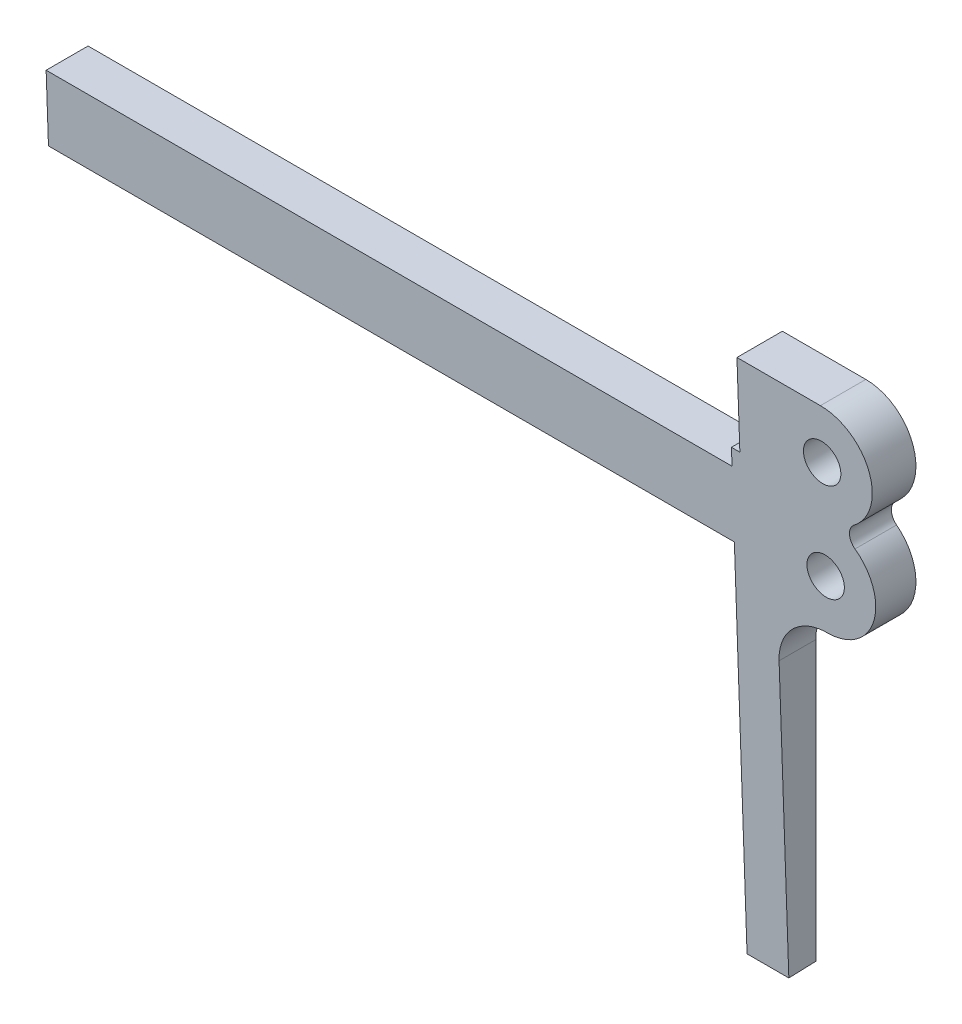
from build123d import *

# Parameters (mm, degrees)
BOSS_EXTRUDE1_OUTLINE_R = 3.556
BOSS_EXTRUDE1_OUTLINE_W = 260.9469
BOSS_EXTRUDE1_OUTLINE_H = 138.1252
BOSS_EXTRUDE1_DEPTH     = 76.2
CUT_EXTRUDE1_DEPTH      = 355.32482824
CUT_EXTRUDE1_DEPTH_BACK = 355.32482824
FILLET1_R               = 2.54
SKETCH7_W               = 260.9469
SKETCH7_H               = 22.1996
CUT_EXTRUDE2_DEPTH      = 347.152897849
FILLET2_R               = 6.35
SKETCH8_W               = 190.775627824
SKETCH8_H               = 235.521960295
CUT_EXTRUDE4_DEPTH      = 347.144751077
SKETCH9_W               = 165.75862987
SKETCH9_H               = 108.368614936
CUT_EXTRUDE5_DEPTH      = 227.747805823


# Read off the part's stored shape, not the designer's step: Boss-Extrude1
with BuildPart() as part:
    # Boss-Extrude1 outline → Boss-Extrude1 (new body)
    with BuildSketch(Plane.XY):
        with BuildLine():
            Line((-286.3596, -22.225), (9.525, -22.225))
            ThreePointArc((9.525, -22.225), (19.05, -12.7), (9.525, -3.175))
            ThreePointArc((9.525, -3.175), (19.05, 6.35), (9.525, 15.875))
            ThreePointArc((9.525, 15.875), (2.789807909, 18.664807909), (0, 25.4))
            Line((0, 25.4), (0, 131.7752))
            ThreePointArc((0, 131.7752), (2.789807909, 138.510392091), (9.525, 141.3002))
            ThreePointArc((9.525, 141.3002), (19.05, 150.8252), (9.525, 160.3502))
            ThreePointArc((9.525, 160.3502), (19.05, 169.8752), (9.525, 179.4002))
            Line((9.525, 179.4002), (-6.35, 179.4002))
            Line((-6.35, 179.4002), (-6.35, 163.5252))
            Line((-6.35, 163.5252), (-7.9502, 163.5252))
            Line((-7.9502, 163.5252), (-7.9502, 160.3502))
            Line((-7.9502, 160.3502), (-268.9098, 160.3502))
            Line((-268.9098, 160.3502), (-268.9098, 163.5252))
            Line((-268.9098, 163.5252), (-270.51, 163.5252))
            Line((-270.51, 163.5252), (-270.51, 179.4002))
            Line((-270.51, 179.4002), (-286.385, 179.4002))
            ThreePointArc((-286.385, 179.4002), (-295.91, 169.8752), (-286.385, 160.3502))
            ThreePointArc((-286.385, 160.3502), (-295.897297883, 150.818850004), (-286.3723, 141.3002))
            ThreePointArc((-286.3723, 141.3002), (-279.637107909, 138.510392091), (-276.8473, 131.7752))
            Line((-276.8473, 131.7752), (-276.8473, 25.4))
            ThreePointArc((-276.8473, 25.4), (-279.637107909, 18.664807909), (-286.3723, 15.875))
            ThreePointArc((-286.3723, 15.875), (-295.8973, 6.35), (-286.3723, -3.175))
            ThreePointArc((-286.3723, -3.175), (-295.884597883, -12.706349996), (-286.3596, -22.225))
        make_face()
        with Locations((-286.3596, -12.7)):
            Circle(BOSS_EXTRUDE1_OUTLINE_R, mode=Mode.SUBTRACT)
        with Locations((-286.3723, 6.35)):
            Circle(BOSS_EXTRUDE1_OUTLINE_R, mode=Mode.SUBTRACT)
        with Locations((9.525, -12.7)):
            Circle(BOSS_EXTRUDE1_OUTLINE_R, mode=Mode.SUBTRACT)
        with Locations((9.525, 6.35)):
            Circle(BOSS_EXTRUDE1_OUTLINE_R, mode=Mode.SUBTRACT)
        with Locations((-286.3723, 150.8252)):
            Circle(BOSS_EXTRUDE1_OUTLINE_R, mode=Mode.SUBTRACT)
        with Locations((-286.385, 169.8752)):
            Circle(BOSS_EXTRUDE1_OUTLINE_R, mode=Mode.SUBTRACT)
        with Locations((-138.42365, 78.5876)):
            Rectangle(BOSS_EXTRUDE1_OUTLINE_W, BOSS_EXTRUDE1_OUTLINE_H, mode=Mode.SUBTRACT)
        with Locations((9.525, 150.8252)):
            Circle(BOSS_EXTRUDE1_OUTLINE_R, mode=Mode.SUBTRACT)
        with Locations((9.525, 169.8752)):
            Circle(BOSS_EXTRUDE1_OUTLINE_R, mode=Mode.SUBTRACT)
    extrude(amount=BOSS_EXTRUDE1_DEPTH)

    # Sketch5 → Cut-Extrude1 (cut, two sides: drawn at the far end of the back side and taken through both)
    with BuildSketch(Plane.ZY.offset(276.8473).offset(-CUT_EXTRUDE1_DEPTH_BACK)):
        Polygon((1.6002, -22.225), (8.641107133, 179.4002), (76.2, 179.4002), (76.2, -22.225), align=None)
    extrude(amount=CUT_EXTRUDE1_DEPTH + CUT_EXTRUDE1_DEPTH_BACK, mode=Mode.SUBTRACT)

    # Fillet1
    fillet1_edges = [part.edges().sort_by_distance(p)[0] for p in [
        (-286.385, 160.3502, 3.987933237),
        (-286.3723, -3.175, 1.132720329),
        (9.525, -3.175, 1.132720329),
        (9.525, 160.3502, 3.987933237),
    ]]
    fillet(fillet1_edges, radius=FILLET1_R)

    # Sketch7 → Cut-Extrude2 (cut, through all)
    with BuildSketch(Plane(origin=(0, 0, 0), x_dir=(-1, 0, 0), z_dir=(0, 0, -1))):
        with Locations((138.42365, -6.35)):
            Rectangle(SKETCH7_W, SKETCH7_H)
    extrude(amount=-CUT_EXTRUDE2_DEPTH, mode=Mode.SUBTRACT)

    # Fillet2
    fillet2_edges = [part.edges().sort_by_distance(p)[0] for p in [
        (-268.8971, 4.7498, 1.271090386),
        (-268.8971, -17.4498, 0.883476829),
        (-7.9502, -17.4498, 0.883476829),
        (-7.9502, 4.7498, 1.271090386),
    ]]
    fillet(fillet2_edges, radius=FILLET2_R)

    # Sketch8 → Cut-Extrude4 (cut, through all)
    with BuildSketch(Plane(origin=(0, -0.082881646, 2.373419811), x_dir=(1, 0, 0), z_dir=(0, -0.03489949670250444, 0.9993908270190958))):
        with Locations((-233.811463912, 74.917246318)):
            Rectangle(SKETCH8_W, SKETCH8_H)
    extrude(amount=-CUT_EXTRUDE4_DEPTH, mode=Mode.SUBTRACT)

    # Sketch9 → Cut-Extrude5 (cut, through all)
    with BuildSketch(Plane(origin=(0, -0.082881646, 2.373419811), x_dir=(1, 0, 0), z_dir=(0, -0.03489949670250444, 0.9993908270190958))):
        with Locations((-55.544335065, 24.534127322)):
            Rectangle(SKETCH9_W, SKETCH9_H)
    extrude(amount=-CUT_EXTRUDE5_DEPTH, mode=Mode.SUBTRACT)


solid = part.part
